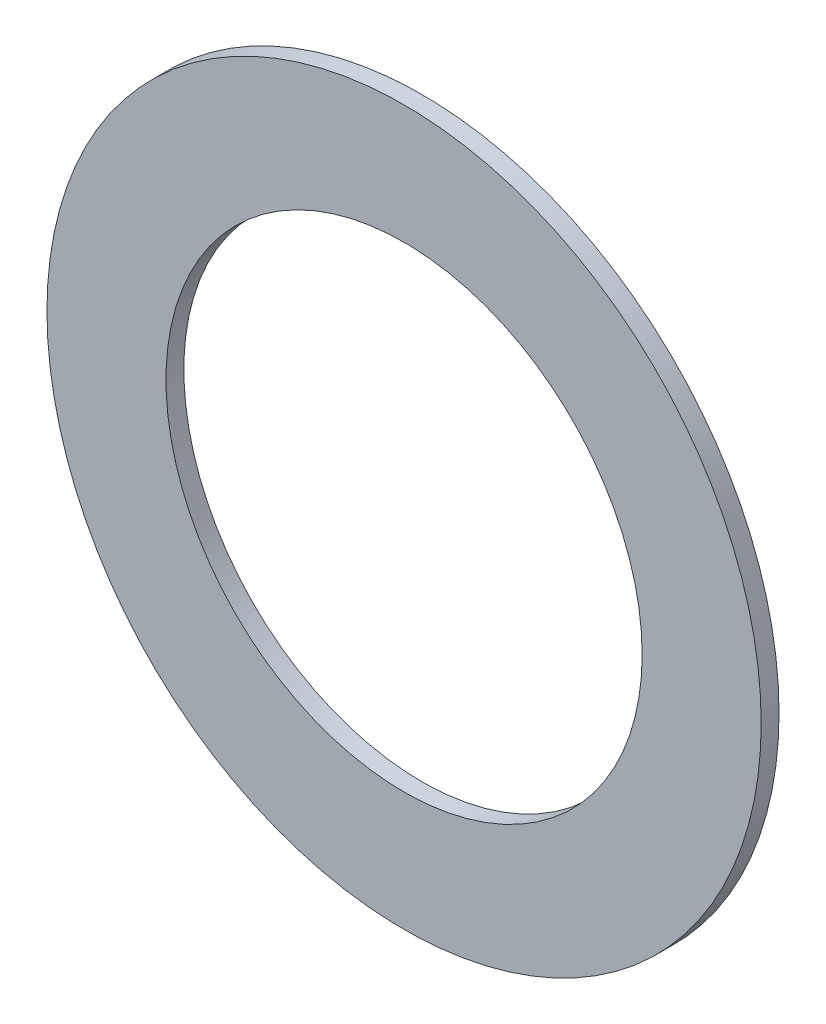
from build123d import *

# Parameters (mm, degrees)
SKETCH1_R           = 30
SKETCH1_R_2         = 20
BOSS_EXTRUDE1_DEPTH = 1.5


with BuildPart() as part:
    # Sketch1 → Boss-Extrude1 (new body)
    with BuildSketch(Plane.XY):
        Circle(SKETCH1_R)
        Circle(SKETCH1_R_2, mode=Mode.SUBTRACT)
    extrude(amount=BOSS_EXTRUDE1_DEPTH)


solid = part.part
